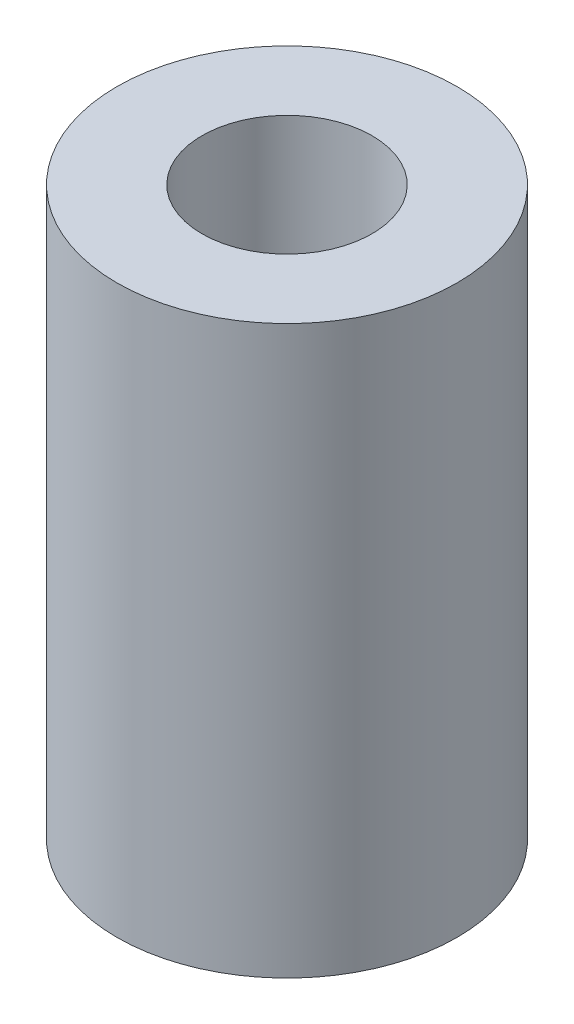
from build123d import *

# Parameters (mm, degrees)
SKETCH1_R           = 3
SKETCH1_R_2         = 1.5
BOSS_EXTRUDE1_DEPTH = 10


with BuildPart() as part:
    # Sketch1 → Boss-Extrude1 (new body)
    with BuildSketch(Plane(origin=(0, 0, 0), x_dir=(1, 0, 0), z_dir=(0, 1, 0))):
        Circle(SKETCH1_R)
        Circle(SKETCH1_R_2, mode=Mode.SUBTRACT)
    extrude(amount=BOSS_EXTRUDE1_DEPTH)


solid = part.part
